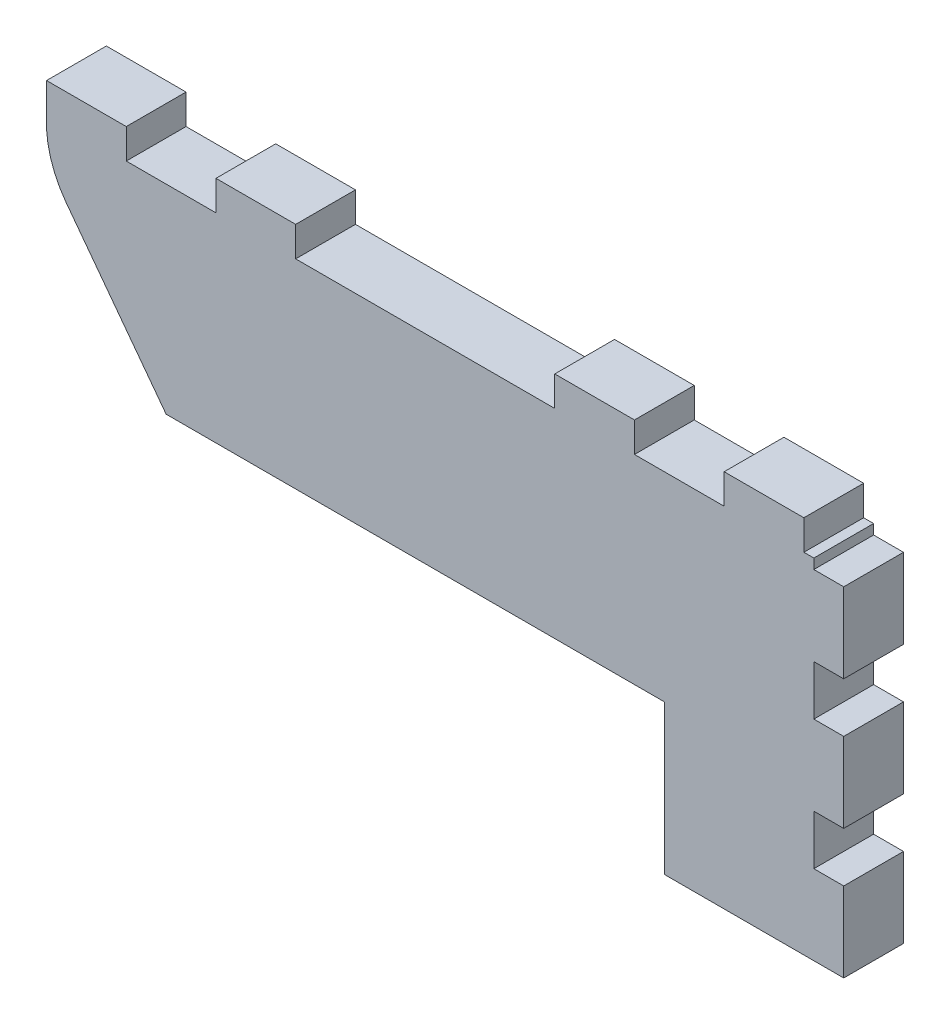
from build123d import *

# Parameters (mm, degrees)
ESQUISSE1_W             = 8
ESQUISSE1_H             = 3
ESQUISSE1_W_2           = 3
ESQUISSE1_H_2           = 8
BOSS_EXTRU_1_DEPTH      = 6
CONG_1_R                = 10
ESQUISSE2_W             = 8
ESQUISSE2_H             = 6
ENL_V_MAT_EXTRU_1_DEPTH = 3


with BuildPart() as part:
    # Esquisse1 → Boss.-Extru.1 (new body)
    with BuildSketch(Plane.XY):
        Polygon((-60, 35), (-69, 35), (-77, 35), (-80, 35), (-65, 15), (-15, 15), (-15, 0), (0, 0), (0, 8), (0, 13), (0, 21), (0, 26), (0, 34), (0, 35), (-1, 35), (-9, 35), (-18, 35), (-26, 35), (-35, 35), (-43, 35), (-52, 35), align=None)
        with Locations((-56, 36.5)):
            Rectangle(ESQUISSE1_W, ESQUISSE1_H)
        with Locations((-39, 36.5)):
            Rectangle(ESQUISSE1_W, ESQUISSE1_H)
        with Locations((-22, 36.5)):
            Rectangle(ESQUISSE1_W, ESQUISSE1_H)
        with Locations((-5, 36.5)):
            Rectangle(ESQUISSE1_W, ESQUISSE1_H)
        with Locations((1.5, 30)):
            Rectangle(ESQUISSE1_W_2, ESQUISSE1_H_2)
        with Locations((1.5, 17)):
            Rectangle(ESQUISSE1_W_2, ESQUISSE1_H_2)
        with Locations((1.5, 4)):
            Rectangle(ESQUISSE1_W_2, ESQUISSE1_H_2)
        with Locations((-73, 36.5)):
            Rectangle(ESQUISSE1_W, ESQUISSE1_H)
    extrude(amount=BOSS_EXTRU_1_DEPTH)

    # Congé1
    # the kernel refuses this fillet: 10 mm, written as the material it takes off along each edge
    with BuildSketch(Plane(origin=(-80, 35, -20.748076809), x_dir=(1, 0, 0), z_dir=(0, 0, 1))) as cong_1_piece_1:
        with BuildLine():
            CenterArc((12.979538434, -0.639384579), CONG_1_R, 176.334095535, 40.535802111)
            Line((4.979538434, -6.639384579), (4.819538434, -6.759384579))
            Line((4.819538434, -6.759384579), (-0.16, -0.12))
            Line((-0.16, -0.12), (0, 0.2))
            ThreePointArc((0, 0.2), (1.5, 0.2), (2.800409231, 0.012787692))
            Line((2.800409231, 0.012787692), (3, 0))
        make_face()
    extrude(amount=47.496153619, mode=Mode.SUBTRACT)

    # Esquisse2 → Enlèv. mat.-Extru.1 (cut)
    with BuildSketch(Plane(origin=(0, 38, 0), x_dir=(1, 0, 0), z_dir=(0, 1, 0))):
        with Locations((-39, -3)):
            Rectangle(ESQUISSE2_W, ESQUISSE2_H)
    extrude(amount=-ENL_V_MAT_EXTRU_1_DEPTH, mode=Mode.SUBTRACT)


solid = part.part
